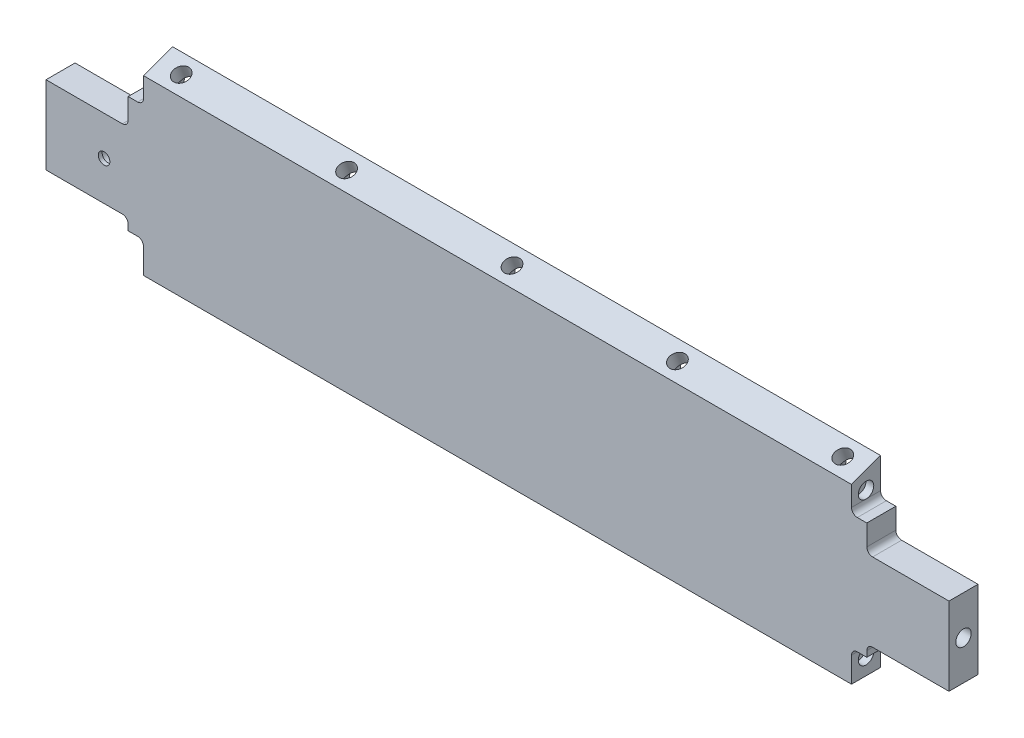
from build123d import *
from OCP.BRepAlgoAPI import BRepAlgoAPI_Cut
from OCP.TopTools import TopTools_ListOfShape

# Parameters (mm, degrees)
BOSS_EXTRUDE1_DEPTH       = 233.25
CUT_EXTRUDE1_DEPTH        = 239.779040355
SKETCH3_R                 = 3
CUT_EXTRUDE2_DEPTH        = 239.779040355
SKETCH5_R                 = 4.1
CUT_EXTRUDE3_DEPTH        = 13
SKETCH6_R                 = 4.1
CUT_EXTRUDE4_DEPTH        = 25
SKETCH_PATTERN2_START     = 9.977772448
SKETCH_PATTERN2_OUTLINE_R = 6
SKETCH_PATTERN2_DEPTH     = 13.981333293
SKETCH8_R                 = 4
CUT_EXTRUDE6_DEPTH        = 25
SKETCH9_R                 = 6
CUT_EXTRUDE7_DEPTH        = 13.5
SKETCH10_R                = 4
CUT_EXTRUDE8_DEPTH        = 25
FILLET1_R                 = 3
SKETCH13_R                = 4
SHOULDER_CLEARANCE_DEPTH  = 4
MIRROR2_START             = 178.9
MIRROR2_OUTLINE_R         = 4
MIRROR2_DEPTH             = 4
CUT_EXTRUDE10_DEPTH       = 12
FILLET2_R                 = 3


with BuildPart() as part:
    # Sketch1 → Boss-Extrude1 (new, symmetric)
    with BuildSketch(Plane(origin=(0, 0, 0), x_dir=(0, 0, -1), z_dir=(1, 0, 0))):
        Polygon((-7.277777322, 43.375552842), (-7.277777322, -46.024447158), (7.722222678, -46.024447158), (7.722222678, 48.835106356), align=None)
    extrude(amount=BOSS_EXTRUDE1_DEPTH, both=True)

    # Sketch2 → Cut-Extrude1 (cut, through all)
    with BuildSketch(Plane.XY.offset(7.277777322)):
        Polygon((-237.03698713, 53.595487325), (-182.9, 53.595487325), (-182.9, 30.080236023), (-190.8, 30.080236023), (-190.8, 16.375552842), (-237.03698713, 16.375552842), align=None)
        Polygon((-277.555936794, -82.894264086), (-182.9, -82.894264086), (-182.9, -30.024447158), (-190.8, -30.024447158), (-190.8, -24.024447158), (-277.555936794, -24.024447158), align=None)
        Polygon((277.555936794, -24.024447158), (190.8, -24.024447158), (190.8, -30.024447158), (182.9, -30.024447158), (182.9, -82.894264086), (277.555936794, -82.894264086), align=None)
        Polygon((237.03698713, 16.375552842), (190.8, 16.375552842), (190.8, 30.080236023), (182.9, 30.080236023), (182.9, 53.595487325), (237.03698713, 53.595487325), align=None)
    extrude(amount=-CUT_EXTRUDE1_DEPTH, mode=Mode.SUBTRACT)

    # Sketch3 → Cut-Extrude2 (cut, through all)
    with BuildSketch(Plane.XY.offset(7.277777322)):
        with Locations((-203.25, -3.824447158)):
            Circle(SKETCH3_R)
    extrude(amount=-CUT_EXTRUDE2_DEPTH, mode=Mode.SUBTRACT)

    # Sketch5 → Cut-Extrude3 (cut)
    with BuildSketch(Plane(origin=(0, 0, -7.722222678), x_dir=(-1, 0, 0), z_dir=(0, 0, -1))):
        with Locations(Location((203.25, -3.824447158, 0), (0, 0, 90))):
            Circle(SKETCH5_R)
    extrude(amount=-CUT_EXTRUDE3_DEPTH, mode=Mode.SUBTRACT)

    # Sketch6 → Cut-Extrude4 (cut)
    with BuildSketch(Plane(origin=(0, 40.640609576, 14.791972188), x_dir=(1, 0, 0), z_dir=(0, 0.9396926207859083, 0.34202014332566905))):
        with Locations(Location((-170.9, 15.977772448, 0), (0, 0, 270))):
            Circle(SKETCH6_R)
        with Locations(Location((-85.45, 15.977772448, 0), (0, 0, 270))):
            Circle(SKETCH6_R)
        with Locations(Location((0, 15.977772448, 0), (0, 0, 270))):
            Circle(SKETCH6_R)
        with Locations(Location((85.45, 15.977772448, 0), (0, 0, 195.822854432))):
            Circle(SKETCH6_R)
        with Locations(Location((170.9, 15.977772448, 0), (0, 0, 195.822854432))):
            Circle(SKETCH6_R)
    extrude(amount=-CUT_EXTRUDE4_DEPTH, mode=Mode.SUBTRACT)

    # Sketch11 → Cut-Revolve1 (revolve, cut)
    with BuildSketch(Plane(origin=(0, 0, 0), x_dir=(0, 0, -1), z_dir=(1, 0, 0)), mode=Mode.PRIVATE) as cut_revolve1_sk:
        Polygon((9.964620122, 36.881139009), (7.912499262, 42.519294734), (-3.363812187, 38.415053014), (-1.311691327, 32.776897289), align=None)
    revolve(cut_revolve1_sk.sketch.rotate(Axis((0, 36.881139009, -9.964620122), (0, 0.3420201433256685, -0.9396926207859085)), 180), axis=Axis((0, 36.881139009, -9.964620122), (0, 0.3420201433256685, -0.9396926207859085)), mode=Mode.SUBTRACT)

    # Sketch-Pattern2: read off the stored shape, not the designer's step
    # Sketch-Pattern2 outline → Sketch-Pattern2 (cut)
    with BuildSketch(Plane(origin=(0, 0, 0), x_dir=(1, 0, 0), z_dir=(0, 0.34202014332566794, -0.9396926207859088)).offset(SKETCH_PATTERN2_START)):
        with Locations((85.45, -31.248833371)):
            Circle(SKETCH_PATTERN2_OUTLINE_R)
        with Locations((170.9, -31.248833371)):
            Circle(SKETCH_PATTERN2_OUTLINE_R)
        with Locations((-85.45, -31.248833371)):
            Circle(SKETCH_PATTERN2_OUTLINE_R)
        with Locations((-170.9, -31.248833371)):
            Circle(SKETCH_PATTERN2_OUTLINE_R)
    extrude(amount=SKETCH_PATTERN2_DEPTH, mode=Mode.SUBTRACT)

    # Sketch8 → Cut-Extrude6 (cut)
    with BuildSketch(Plane.XZ.offset(46.024447158)):
        with Locations(Location((-170.9, -0.222222678, 0), (0, 0, 270))):
            Circle(SKETCH8_R)
        with Locations(Location((-85.45, -0.222222678, 0), (0, 0, 270))):
            Circle(SKETCH8_R)
        with Locations(Location((0, -0.222222678, 0), (0, 0, 270))):
            Circle(SKETCH8_R)
        with Locations(Location((170.9, -0.222222678, 0), (0, 0, 90))):
            Circle(SKETCH8_R)
        with Locations(Location((85.45, -0.222222678, 0), (0, 0, 90))):
            Circle(SKETCH8_R)
    extrude(amount=-CUT_EXTRUDE6_DEPTH, mode=Mode.SUBTRACT)

    # Sketch9 → Cut-Extrude7 (cut)
    with BuildSketch(Plane(origin=(0, 0, -7.722222678), x_dir=(-1, 0, 0), z_dir=(0, 0, -1))):
        with Locations(Location((-221.25, -3.824447158, 0), (0, 0, 90))):
            Circle(SKETCH9_R)
        with Locations(Location((-170.9, -34.024447158, 0), (0, 0, 90))):
            Circle(SKETCH9_R)
        with Locations(Location((-85.45, -34.024447158, 0), (0, 0, 90))):
            Circle(SKETCH9_R)
        with Locations(Location((0, -34.024447158, 0), (0, 0, 90))):
            Circle(SKETCH9_R)
        with Locations(Location((221.25, -3.824447158, 0), (0, 0, 270))):
            Circle(SKETCH9_R)
        with Locations(Location((170.9, -34.024447158, 0), (0, 0, 270))):
            Circle(SKETCH9_R)
        with Locations(Location((85.45, -34.024447158, 0), (0, 0, 270))):
            Circle(SKETCH9_R)
    extrude(amount=-CUT_EXTRUDE7_DEPTH, mode=Mode.SUBTRACT)

    # Sketch10 → Cut-Extrude8 (cut)
    with BuildSketch(Plane(origin=(233.25, 0, 0), x_dir=(0, 0, -1), z_dir=(1, 0, 0))):
        with Locations((0.222222678, -3.824447158)):
            Circle(SKETCH10_R)
    cut_extrude8 = extrude(amount=-CUT_EXTRUDE8_DEPTH, mode=Mode.SUBTRACT)

    # Mirror1: Cut-Extrude8 across plane
    add(cut_extrude8.mirror(Plane(origin=(0, 0, 0), x_dir=(0, 0, 1), z_dir=(1, 0, 0))), mode=Mode.SUBTRACT)

    # Fillet1
    fillet1_edges = [part.edges().sort_by_distance(p)[0] for p in [
        (-182.9, 30.080236023, -0.222222678),
        (-190.8, 16.375552842, -0.222222678),
        (190.8, -24.024447158, -0.222222678),
        (182.9, -30.024447158, -0.222222678),
        (-182.9, -30.024447158, -0.222222678),
        (-190.8, -24.024447158, -0.222222678),
        (182.9, 30.080236023, -0.222222678),
        (190.8, 16.375552842, -0.222222678),
    ]]
    fillet(fillet1_edges, radius=FILLET1_R)


with BuildPart() as shoulder_clearance_tool:
    # Sketch13 → shoulder clearance (new body)
    with BuildSketch(Plane.ZY.offset(182.9)):
        with Locations((-0.222222678, -37.124447158)):
            Circle(SKETCH13_R)
        with Locations((-0.222222678, 37.075552842)):
            Circle(SKETCH13_R)
    extrude(amount=-SHOULDER_CLEARANCE_DEPTH)


with BuildPart() as part_1:
    add(part.part)

    # shoulder clearance: cut by shoulder_clearance_tool, with a tolerance
    shoulder_clearance_stock = TopTools_ListOfShape()
    shoulder_clearance_stock.Append(part_1.part.wrapped)
    shoulder_clearance_tools = TopTools_ListOfShape()
    shoulder_clearance_tools.Append(shoulder_clearance_tool.part.wrapped)
    shoulder_clearance_cut = BRepAlgoAPI_Cut()
    shoulder_clearance_cut.SetArguments(shoulder_clearance_stock)
    shoulder_clearance_cut.SetTools(shoulder_clearance_tools)
    shoulder_clearance_cut.SetFuzzyValue(0.00001)
    shoulder_clearance_cut.Build()
    add(Compound.cast(shoulder_clearance_cut.Shape()).solids(), mode=Mode.REPLACE)


with BuildPart() as mirror2_tool:
    # Mirror2: read off the stored shape, not the designer's step
    # Mirror2 outline → Mirror2 (new body)
    with BuildSketch(Plane.YZ.offset(MIRROR2_START)):
        with Locations((-37.124447158, -0.222222678)):
            Circle(MIRROR2_OUTLINE_R)
        with Locations((37.075552842, -0.222222678)):
            Circle(MIRROR2_OUTLINE_R)
    extrude(amount=MIRROR2_DEPTH)


with BuildPart() as part_2:
    add(part_1.part)

    # Mirror2: cut by mirror2_tool, with a tolerance
    mirror2_stock = TopTools_ListOfShape()
    mirror2_stock.Append(part_2.part.wrapped)
    mirror2_tools = TopTools_ListOfShape()
    mirror2_tools.Append(mirror2_tool.part.wrapped)
    mirror2_cut = BRepAlgoAPI_Cut()
    mirror2_cut.SetArguments(mirror2_stock)
    mirror2_cut.SetTools(mirror2_tools)
    mirror2_cut.SetFuzzyValue(0.00001)
    mirror2_cut.Build()
    add(Compound.cast(mirror2_cut.Shape()).solids(), mode=Mode.REPLACE)

    # Sketch14 → Cut-Extrude10 (cut)
    with BuildSketch(Plane(origin=(0, 0, -7.722222678), x_dir=(-1, 0, 0), z_dir=(0, 0, -1))):
        Polygon((-164.962045677, 21.335106356), (-139.457198069, 21.335106356), (-139.457198069, 32.335106356), (-104.025039749, 32.335106356), (-104.025039749, -19.001619957), (-139.457198069, -19.001619957), (-139.457198069, -8.092700671), (-164.962045677, -8.092700671), align=None)
    extrude(amount=-CUT_EXTRUDE10_DEPTH, mode=Mode.SUBTRACT)

    # Fillet2
    fillet2_edges = [part_2.edges().sort_by_distance(p)[0] for p in [
        (139.457198069, 32.335106356, -1.722222678),
        (104.025039749, 32.335106356, -1.722222678),
        (104.025039749, -19.001619957, -1.722222678),
        (139.457198069, -19.001619957, -1.722222678),
        (139.457198069, -8.092700671, -1.722222678),
        (164.962045677, -8.092700671, -1.722222678),
        (164.962045677, 21.335106356, -1.722222678),
        (139.457198069, 21.335106356, -1.722222678),
    ]]
    fillet(fillet2_edges, radius=FILLET2_R)


solid = part_2.part
